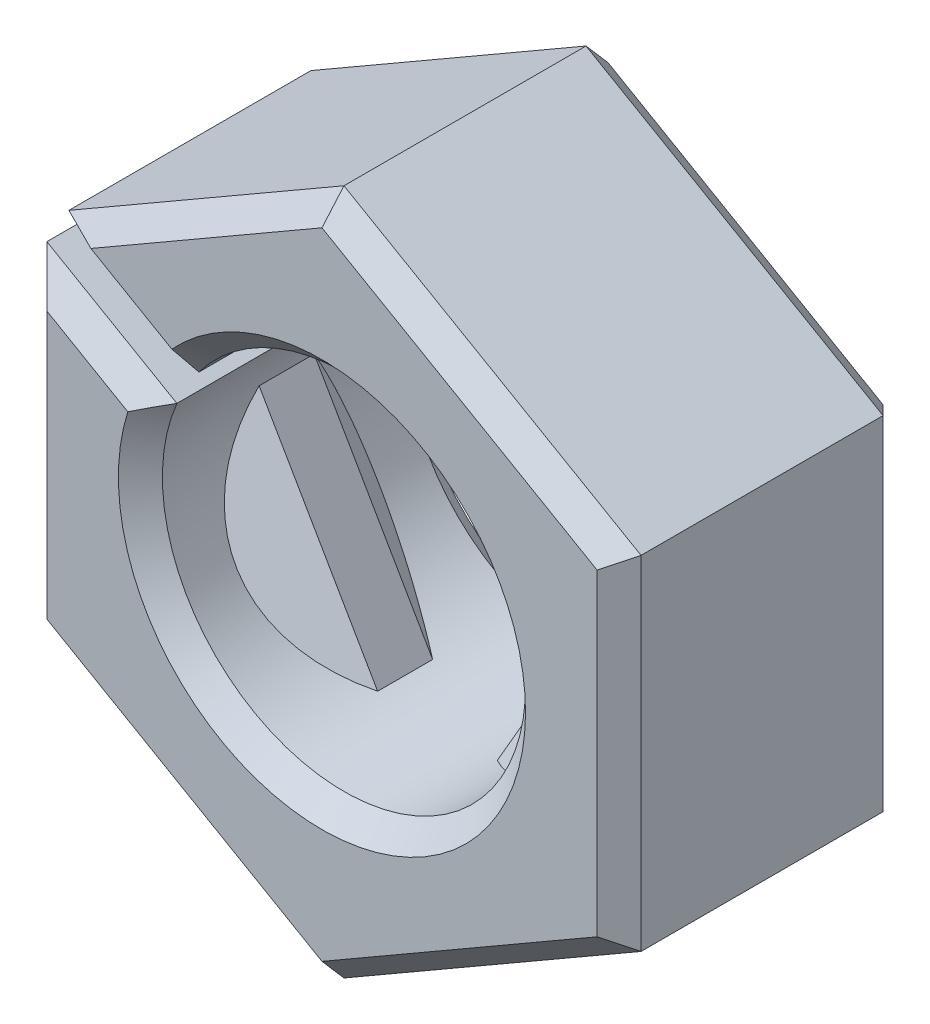
from build123d import *

# Parameters (mm, degrees)
SKETCH1_R              = 1.65
BOSS_EXTRUDE1_DEPTH    = 1.3
CLIP_REACH             = 6.324
CLIP_DIRECTION_2_REACH = 6.324
CLIPS_X3_COUNT         = 3
SPLIT_2_DEPTH          = 5.324349662
SPLIT_2_DEPTH_BACK     = 5.324349662
DEBURS_SIZE            = 0.2


with BuildPart() as part:
    # Sketch1 → Boss-Extrude1 (new, symmetric)
    with BuildSketch(Plane.XY):
        Polygon((2.7, -1.558845727), (2.7, 1.558845727), (0, 3.117691454), (-2.7, 1.558845727), (-2.7, -1.558845727), (0, -3.117691454), align=None)
        Circle(SKETCH1_R, mode=Mode.SUBTRACT)
    extrude(amount=BOSS_EXTRUDE1_DEPTH, both=True)

    # Sketch3 → Clip (add, up to next)
    with BuildSketch(Plane(origin=(0, 0, 0), x_dir=(0, 0, -1), z_dir=(1, 0, 0)), mode=Mode.PRIVATE) as clip_sk1:
        Polygon((-0.65, 1.65), (0.65, 1.65), (0.25, 1.25), (-0.25, 1.25), align=None)
    clip_tool1 = extrude(clip_sk1.sketch, amount=CLIP_REACH, mode=Mode.PRIVATE) - part.part
    clip = clip_tool1.solids().sort_by_distance((0, 1.47963, 0))[0]
    add(clip)

    # Sketch3 → Clip direction 2 (add, up to next)
    with BuildSketch(Plane(origin=(0, 0, 0), x_dir=(0, 0, -1), z_dir=(1, 0, 0)), mode=Mode.PRIVATE) as clip_direction_2_sk1:
        Polygon((-0.65, 1.65), (0.65, 1.65), (0.25, 1.25), (-0.25, 1.25), align=None)
    clip_direction_2_tool1 = extrude(clip_direction_2_sk1.sketch, amount=-CLIP_DIRECTION_2_REACH, mode=Mode.PRIVATE) - part.part
    clip_direction_2 = clip_direction_2_tool1.solids().sort_by_distance((0, 1.47963, 0))[0]
    add(clip_direction_2)

    # Clips x3: Clip, Clip direction 2 ×3 about axis
    clips_x3_axis = Axis((0, 0, 1.3), (0, 0, 1))
    add([clip.rotate(clips_x3_axis, i * 360 / CLIPS_X3_COUNT) for i in range(1, CLIPS_X3_COUNT)])
    add([clip_direction_2.rotate(clips_x3_axis, i * 360 / CLIPS_X3_COUNT) for i in range(1, CLIPS_X3_COUNT)])

    # Sketch4 → Split 2 (cut, two sides: drawn at the far end of the back side and taken through both)
    with BuildSketch(Plane.XY.offset(-SPLIT_2_DEPTH_BACK)):
        Polygon((-2.8, 1.385640646), (-0.1, -0.173205081), (0.1, 0.173205081), (-2.6, 1.732050808), align=None)
    extrude(amount=SPLIT_2_DEPTH + SPLIT_2_DEPTH_BACK, mode=Mode.SUBTRACT)

    # Deburs
    deburs_edges = [part.edges().sort_by_distance(p)[0] for p in [
        (-0.329492365, -1.616766768, -1.3),
        (2.7, 0, -1.3),
        (1.35, 2.33826859, -1.3),
        (-1.25, 2.396003617, -1.3),
        (-2.7, -0.115470054, -1.3),
        (-1.35, -2.33826859, -1.3),
        (1.35, -2.33826859, -1.3),
        (-0.329492365, -1.616766768, 1.3),
        (-1.35, -2.33826859, 1.3),
        (-2.7, -0.115470054, 1.3),
        (-1.25, 2.396003617, 1.3),
        (1.35, 2.33826859, 1.3),
        (2.7, 0, 1.3),
        (1.35, -2.33826859, 1.3),
        (-1.909202898, 1.333218915, -1.3),
        (-2.109202898, 0.986808753, -1.3),
        (-1.909202898, 1.333218915, 1.3),
        (-2.109202898, 0.986808753, 1.3),
    ]]
    chamfer(deburs_edges, length=DEBURS_SIZE)


solid = part.part
